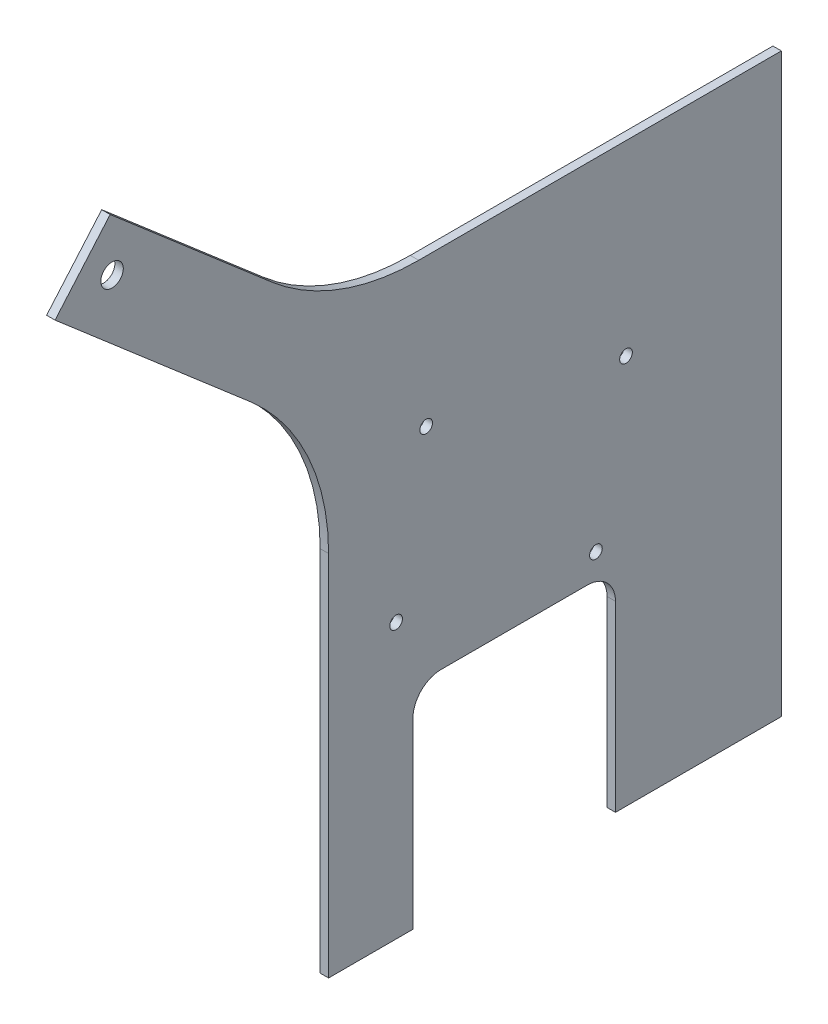
from build123d import *

# Parameters (mm, degrees)
SKETCH_1_R             = 4
EXTRUDE_1_DEPTH        = 1.5
CUT_EXTRUDE_1_DEPTH    = 318.767533759
HOLE_WIZARD_M4_1_D     = 4.5
HOLE_WIZARD_M4_1_DEPTH = 4
HOLE_WIZARD_M4_1_TIP   = 1.351936393


with BuildPart() as part:
    # 草图1 → 凸台-拉伸1 (new, symmetric)
    with BuildSketch(Plane(origin=(0, 0, 0), x_dir=(0, 0, -1), z_dir=(1, 0, 0))):
        with BuildLine():
            Line((-27.769667841, 191.317400645), (-97.269946411, 251.221762497))
            Line((-97.269946411, 251.221762497), (-77.683571852, 273.9456251))
            Line((-77.683571852, 273.9456251), (-20.204886802, 224.403033058))
            ThreePointArc((-20.204886802, 224.403033058), (4.166491279, 210.007475855), (32.025445357, 205))
            Line((32.025445357, 205), (161, 205))
            Line((161, 205), (161, 0))
            Line((161, 0), (0, 0))
            Line((0, 0), (0, 130.720433703))
            ThreePointArc((0, 130.720433703), (-7.273022293, 164.048900719), (-27.769667841, 191.317400645))
        make_face()
        with Locations((-77, 255)):
            Circle(SKETCH_1_R, mode=Mode.SUBTRACT)
    extrude(amount=EXTRUDE_1_DEPTH, both=True)

    # 草图2 → 切除-拉伸1 (cut, through all)
    with BuildSketch(Plane(origin=(1.5, 0, 0), x_dir=(0, 0, -1), z_dir=(1, 0, 0))):
        with BuildLine():
            Line((30, 0), (102, 0))
            Line((102, 0), (102, 65))
            ThreePointArc((102, 65), (99.071067812, 72.071067812), (92, 75))
            Line((92, 75), (40, 75))
            ThreePointArc((40, 75), (32.928932188, 72.071067812), (30, 65))
            Line((30, 65), (30, 0))
        make_face()
    extrude(amount=-CUT_EXTRUDE_1_DEPTH, mode=Mode.SUBTRACT)

    # M4 间隙孔1
    with Locations(Plane(origin=(1.5, 0, 0), x_dir=(0, 0, -1), z_dir=(1, 0, 0))):
        with Locations((34.69, 152.500209205), (24, 97.53), (105.749337125, 138.681373059), (95.059337125, 83.711163855)):
            Hole(HOLE_WIZARD_M4_1_D / 2, depth=HOLE_WIZARD_M4_1_DEPTH)
            with Locations((0, 0, -(HOLE_WIZARD_M4_1_DEPTH + HOLE_WIZARD_M4_1_TIP / 2))):  # 118° drill point
                Cone(0, HOLE_WIZARD_M4_1_D / 2, HOLE_WIZARD_M4_1_TIP, mode=Mode.SUBTRACT)


solid = part.part
